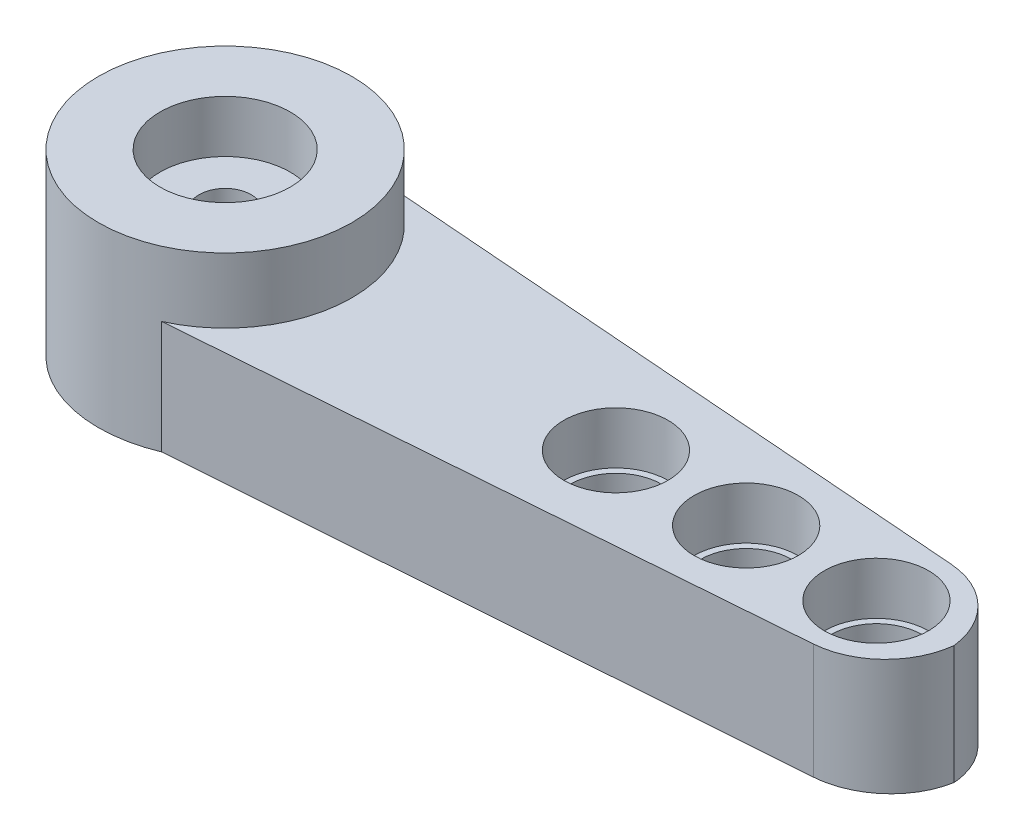
from build123d import *
from build123d.topology import SkipClean

# Parameters (mm, degrees)
SKETCH1_R                = 0.6
BOSS_EXTRUDE1_DEPTH      = 1.4
SKETCH2_R                = 2.6
CUT_EXTRUDE1_DEPTH       = 1
SKETCH3_R                = 3.5
SKETCH3_R_2              = 1
BOSS_EXTRUDE2_DEPTH      = 2.5
SKETCH4_R                = 1.2
CUT_EXTRUDE2_DEPTH       = 20.282440198
SKETCH6_W                = 35.735260114
SKETCH6_H                = 17.672039004
CUT_EXTRUDE4_DEPTH       = 20.513392837
CUT_EXTRUDE5_DEPTH       = 18.980545042
SKETCH_1_R               = 0.75
EXTRUDE_1_DEPTH          = 2
EXTRUDE_START            = 0.6
SKETCH_2_R               = 0.6
SKETCH_2_R_2             = 2.6
EXTRUDE_2_DEPTH          = 0.6
CUT_EXTRUDE_1_DEPTH      = 26.836795467
CUT_EXTRUDE_1_DEPTH_BACK = 26.836795467
SKETCH_3_R               = 0.75
SKETCH_3_R_2             = 0.6
EXTRUDE_3_REACH          = 27.837
EXTRUDE_4_DEPTH          = 2
CUT_EXTRUDE_2_DEPTH      = 10
CUT_EXTRUDE_2_DEPTH_BACK = 2
SKETCH_7_R               = 2
FILLET_1_R               = 3
EXTRUDE_START_2          = 3
SKETCH_9_R               = 1.75
SKETCH_9_R_2             = 2.6
EXTRUDE_5_DEPTH          = 3
EXTRUDE_START_3          = -5
SKETCH_10_R              = 4.86502339
SKETCH_10_R_2            = 3.625748898
EXTRUDE_6_DEPTH          = 5
CUT_EXTRUDE_5_DEPTH      = 0.6
CUT_EXTRUDE_5_DEPTH_BACK = 30.442340009
SKETCH_13_W              = 39.79025269
SKETCH_13_H              = 26.985080274
EXTRUDE_START_4          = -2.9
SKETCH_14_R              = 4.86502339
SKETCH_14_R_2            = 1
EXTRUDE_7_DEPTH          = 2.9
SKETCH_15_R              = 2.5
CUT_EXTRUDE_6_DEPTH      = 2
EXTRUDE_START_5          = 2
SKETCH_16_R              = 2.6
SKETCH_16_R_2            = 1
EXTRUDE_8_DEPTH          = 2


with BuildPart() as part:
    # Sketch1 → Boss-Extrude1 (new body)
    with BuildSketch(Plane(origin=(0, 0, 0), x_dir=(1, 0, 0), z_dir=(0, 1, 0))):
        with BuildLine():
            Line((-15.2, 2), (-2, 2.95))
            Line((-2, 2.95), (-2, 6.35))
            ThreePointArc((-2, 6.35), (0, 8.35), (2, 6.35))
            Line((2, 6.35), (2, 3.5))
            Line((2, 3.5), (15.2, 2))
            ThreePointArc((15.2, 2), (17.2, 0), (15.2, -2))
            Line((15.2, -2), (2, -3.5))
            Line((2, -3.5), (2, -6.35))
            ThreePointArc((2, -6.35), (0, -8.35), (-2, -6.35))
            Line((-2, -6.35), (-2, -2.95))
            Line((-2, -2.95), (-15.2, -2))
            ThreePointArc((-15.2, -2), (-17.2, 0), (-15.2, 2))
        make_face()
        with Locations(Location((0, 6.35, 0), (0, 0, 270))):
            Circle(SKETCH1_R, mode=Mode.SUBTRACT)
        with Locations(Location((0, 4.75, 0), (0, 0, 270))):
            Circle(SKETCH1_R, mode=Mode.SUBTRACT)
        with Locations(Location((0, -4.75, 0), (0, 0, 90))):
            Circle(SKETCH1_R, mode=Mode.SUBTRACT)
        with Locations(Location((0, -6.35, 0), (0, 0, 90))):
            Circle(SKETCH1_R, mode=Mode.SUBTRACT)
        with Locations(Location((-15.2, 0, 0), (0, 0, 270))):
            Circle(SKETCH1_R, mode=Mode.SUBTRACT)
        with Locations(Location((15.2, 0, 0), (0, 0, 270))):
            Circle(SKETCH1_R, mode=Mode.SUBTRACT)
        with Locations(Location((-13.4, 0, 0), (0, 0, 270))):
            Circle(SKETCH1_R, mode=Mode.SUBTRACT)
        with Locations(Location((-11.6, 0, 0), (0, 0, 270))):
            Circle(SKETCH1_R, mode=Mode.SUBTRACT)
        with Locations(Location((-9.8, 0, 0), (0, 0, 270))):
            Circle(SKETCH1_R, mode=Mode.SUBTRACT)
        with Locations(Location((-8, 0, 0), (0, 0, 270))):
            Circle(SKETCH1_R, mode=Mode.SUBTRACT)
        with Locations(Location((-6.2, 0, 0), (0, 0, 270))):
            Circle(SKETCH1_R, mode=Mode.SUBTRACT)
        with Locations(Location((-4.4, 0, 0), (0, 0, 270))):
            Circle(SKETCH1_R, mode=Mode.SUBTRACT)
        with Locations(Location((13.4, 0, 0), (0, 0, 270))):
            Circle(SKETCH1_R, mode=Mode.SUBTRACT)
        with Locations(Location((11.6, 0, 0), (0, 0, 270))):
            Circle(SKETCH1_R, mode=Mode.SUBTRACT)
        with Locations(Location((9.8, 0, 0), (0, 0, 270))):
            Circle(SKETCH1_R, mode=Mode.SUBTRACT)
        with Locations(Location((8, 0, 0), (0, 0, 270))):
            Circle(SKETCH1_R, mode=Mode.SUBTRACT)
        with Locations(Location((6.2, 0, 0), (0, 0, 270))):
            Circle(SKETCH1_R, mode=Mode.SUBTRACT)
        with Locations(Location((4.4, 0, 0), (0, 0, 270))):
            Circle(SKETCH1_R, mode=Mode.SUBTRACT)
    extrude(amount=BOSS_EXTRUDE1_DEPTH)

    # Sketch2 → Cut-Extrude1 (cut)
    with BuildSketch(Plane.XZ):
        with Locations(Location((0, 0, 0), (0, 0, 270))):
            Circle(SKETCH2_R)
    extrude(amount=-CUT_EXTRUDE1_DEPTH, mode=Mode.SUBTRACT)

    # Sketch3 → Boss-Extrude2 (add)
    with BuildSketch(Plane(origin=(0, 1.4, 0), x_dir=(1, 0, 0), z_dir=(0, 1, 0))):
        with Locations(Location((0, 0, 0), (0, 0, 270))):
            Circle(SKETCH3_R)
        with Locations(Location((0, 0, 0), (0, 0, 270))):
            Circle(SKETCH3_R_2, mode=Mode.SUBTRACT)
    extrude(amount=BOSS_EXTRUDE2_DEPTH)

    # Sketch4 → Cut-Extrude2 (cut, through all)
    with BuildSketch(Plane(origin=(0, 1.4, 0), x_dir=(1, 0, 0), z_dir=(0, 1, 0))):
        with Locations(Location((0, 0, 0), (0, 0, 270))):
            Circle(SKETCH4_R)
    extrude(amount=-CUT_EXTRUDE2_DEPTH, mode=Mode.SUBTRACT)

    # Sketch6 → Cut-Extrude4 (cut, through all)
    with BuildSketch(Plane.XZ):
        Rectangle(SKETCH6_W, SKETCH6_H)
        with BuildLine():
            Line((-1.868584713, -2.959457918), (-15.2, -2))
            ThreePointArc((-15.2, -2), (-17.2, 0), (-15.2, 2))
            Line((-15.2, 2), (-1.868584713, 2.959457918))
            ThreePointArc((-1.868584713, 2.959457918), (0, 3.5), (1.868584713, 2.959457918))
            Line((1.868584713, 2.959457918), (15.2, 2))
            ThreePointArc((15.2, 2), (17.2, 0), (15.2, -2))
            Line((15.2, -2), (1.868584713, -2.959457918))
            ThreePointArc((1.868584713, -2.959457918), (0, -3.5), (-1.868584713, -2.959457918))
        make_face(mode=Mode.SUBTRACT)
    extrude(amount=-CUT_EXTRUDE4_DEPTH, mode=Mode.SUBTRACT)

    # Sketch7 → Cut-Extrude5 (cut, through all)
    with BuildSketch(Plane.XZ):
        with BuildLine():
            Line((0, 3.5), (-17.731768104, 3.5))
            Line((-17.731768104, 3.5), (-17.731768104, -3.5))
            Line((-17.731768104, -3.5), (0, -3.5))
            ThreePointArc((0, -3.5), (-3.5, 0), (0, 3.5))
        make_face()
    extrude(amount=-CUT_EXTRUDE5_DEPTH, mode=Mode.SUBTRACT)

    # 草圖1 → 填料-伸長1 (add)
    with BuildSketch(Plane(origin=(0, 1.4, 0), x_dir=(1, 0, 0), z_dir=(0, 1, 0))):
        with BuildLine():
            Line((15.2, 2), (23.2, 2))
            ThreePointArc((23.2, 2), (25.2, 0), (23.2, -2))
            Line((23.2, -2), (15.2, -2))
            Line((15.2, -2), (15.2, 2))
        make_face()
        with Locations(Location((17.2, 0, 0), (0, 0, 270))):
            Circle(SKETCH_1_R, mode=Mode.SUBTRACT)
        with Locations(Location((19.2, 0, 0), (0, 0, 270))):
            Circle(SKETCH_1_R, mode=Mode.SUBTRACT)
        with Locations(Location((21.2, 0, 0), (0, 0, 270))):
            Circle(SKETCH_1_R, mode=Mode.SUBTRACT)
        with Locations(Location((23.2, 0, 0), (0, 0, 270))):
            Circle(SKETCH_1_R, mode=Mode.SUBTRACT)
    extrude(amount=-EXTRUDE_1_DEPTH)

    # 草圖2 → 填料-伸長2 (add)
    with SkipClean():  # the faces are left unmerged after this step: merging them gives an invalid solid
        with BuildSketch(Plane.XZ.offset(EXTRUDE_START)):
            with BuildLine():
                ThreePointArc((1.868584713, 2.959457918), (-3.5, 0), (1.868584713, -2.959457918))
                Line((1.868584713, -2.959457918), (15.2, -2))
                Line((15.2, -2), (15.2, -0.6))
                ThreePointArc((15.2, -0.6), (14.6, 0), (15.2, 0.6))
                Line((15.2, 0.6), (15.2, 2))
                Line((15.2, 2), (1.868584713, 2.959457918))
            make_face()
            with Locations(Location((11.6, 0, 0), (0, 0, 270))):
                Circle(SKETCH_2_R, mode=Mode.SUBTRACT)
            with Locations(Location((8, 0, 0), (0, 0, 270))):
                Circle(SKETCH_2_R, mode=Mode.SUBTRACT)
            with Locations(Location((4.4, 0, 0), (0, 0, 270))):
                Circle(SKETCH_2_R, mode=Mode.SUBTRACT)
            with Locations(Location((6.2, 0, 0), (0, 0, 270))):
                Circle(SKETCH_2_R, mode=Mode.SUBTRACT)
            with Locations(Location((9.8, 0, 0), (0, 0, 270))):
                Circle(SKETCH_2_R, mode=Mode.SUBTRACT)
            with Locations(Location((13.4, 0, 0), (0, 0, 270))):
                Circle(SKETCH_2_R, mode=Mode.SUBTRACT)
            with Locations(Location((0, 0, 0), (0, 0, 270))):
                Circle(SKETCH_2_R_2, mode=Mode.SUBTRACT)
        extrude(amount=-EXTRUDE_2_DEPTH)

    # 草圖3 → 除料-伸長1 (cut, two sides: drawn at the far end of the back side and taken through both)
    with SkipClean():  # the faces are left unmerged after this step: merging them gives an invalid solid
        with BuildSketch(Plane.XZ.offset(0.6).offset(-CUT_EXTRUDE_1_DEPTH_BACK)):
            with Locations(Location((17.2, 0, 0), (0, 0, 90))):
                Circle(SKETCH_3_R)
            with Locations(Location((15.2, 0, 0), (0, 0, 270))):
                Circle(SKETCH_3_R_2)
        extrude(amount=CUT_EXTRUDE_1_DEPTH + CUT_EXTRUDE_1_DEPTH_BACK, mode=Mode.SUBTRACT)

    # 填料-伸長3: up to this face of the body (flat: up to its plane)
    extrude_3_end = Plane(part.part.faces().sort_by_distance((0, 3.9, -3.401005051))[0])
    # 草圖4 → 填料-伸長3 (add, up to the picked face)
    with BuildSketch(Plane.XZ.offset(0.6), mode=Mode.PRIVATE) as extrude_3_sk1:
        with BuildLine():
            Line((1.868584713, 2.959457918), (3.972845963, 2.808014874))
            ThreePointArc((3.972845963, 2.808014874), (-4.86502339, 0), (3.972845963, -2.808014874))
            Line((3.972845963, -2.808014874), (1.868584713, -2.959457918))
            ThreePointArc((1.868584713, -2.959457918), (-3.5, 0), (1.868584713, 2.959457918))
        make_face()
    extrude_3_tool1 = split(extrude(extrude_3_sk1.sketch, amount=-EXTRUDE_3_REACH, mode=Mode.PRIVATE), bisect_by=extrude_3_end, keep=Keep.BOTH, mode=Mode.PRIVATE)
    add(extrude_3_tool1.solids().sort_by(Axis((2.930151, -0.6, -3.014844), (0, 1, 0)))[0])

    # 草圖5 → 填料-伸長4 (add)
    with BuildSketch(Plane.XZ.offset(0.6)):
        Polygon((2, 4.434912917), (28, 2.434912917), (28, -2.434912917), (2, -4.434912917), (3, 0), align=None)
    extrude(amount=-EXTRUDE_4_DEPTH)

    # 草圖7 → 除料-伸長2 (cut, two sides: drawn at the far end of the back side and taken through both)
    with BuildSketch(Plane.XZ.offset(0.6).offset(-CUT_EXTRUDE_2_DEPTH_BACK)):
        with Locations(Location((15, 0, 0), (0, 0, 90))):
            Circle(SKETCH_7_R)
        with Locations(Location((25, 0, 0), (0, 0, 90))):
            Circle(SKETCH_7_R)
        with Locations(Location((20, 0, 0), (0, 0, 90))):
            Circle(SKETCH_7_R)
    extrude(amount=CUT_EXTRUDE_2_DEPTH + CUT_EXTRUDE_2_DEPTH_BACK, mode=Mode.SUBTRACT)

    # 圓角1
    # the kernel refuses this fillet: 3 mm, written as the material it takes off along each edge
    with BuildSketch(Plane(origin=(28, -7.545233544, -2.434912917), x_dir=(-0.9970544855015815, 0, -0.07669649888473681), z_dir=(0, 1, 0)), Plane(origin=(28, -7.545233544, 2.434912917), x_dir=(0, 0, -1), z_dir=(0, 1, 0))) as fillet_1_piece_1:
        with BuildLine():
            CenterArc((FILLET_1_R * 0.926031139262, FILLET_1_R), FILLET_1_R, 184.398705355, 85.601294645)
            Line((-FILLET_1_R * 0.0710233462396, FILLET_1_R * 0.923303501115), (0, 0))
            Line((0, 0), (FILLET_1_R * 0.926031139262, 0))
        make_face()
    extrude(amount=15.890467089, mode=Mode.SUBTRACT)

    # 草圖9 → 填料-伸長5 (add)
    with BuildSketch(Plane.XZ.offset(0.6).offset(EXTRUDE_START_2)):
        with BuildLine():
            Line((2, -4.434912917), (25.230089497, -2.647982956))
            ThreePointArc((25.230089497, -2.647982956), (27.080772484, -1.817927055), (27.980306552, 0))
            ThreePointArc((27.980306552, 0), (27.080772484, 1.817927055), (25.230089497, 2.647982956))
            Line((25.230089497, 2.647982956), (2, 4.434912917))
            ThreePointArc((2, 4.434912917), (-4.86502339, 0), (2, -4.434912917))
        make_face()
        with Locations(Location((20, 0, 0), (0, 0, 270))):
            Circle(SKETCH_9_R, mode=Mode.SUBTRACT)
        with Locations(Location((0, 0, 0), (0, 0, 270))):
            Circle(SKETCH_9_R_2, mode=Mode.SUBTRACT)
        with Locations(Location((15, 0, 0), (0, 0, 270))):
            Circle(SKETCH_9_R, mode=Mode.SUBTRACT)
        with Locations(Location((25, 0, 0), (0, 0, 270))):
            Circle(SKETCH_9_R, mode=Mode.SUBTRACT)
    extrude(amount=-EXTRUDE_5_DEPTH)

    # 草圖10 → 填料-伸長6 (add)
    with SkipClean():  # the faces are left unmerged after this step: merging them gives an invalid solid
        with BuildSketch(Plane(origin=(0, 3.9, 0), x_dir=(1, 0, 0), z_dir=(0, 1, 0)).offset(EXTRUDE_START_3)):
            with Locations(Location((0, 0, 0), (0, 0, 65.726189772))):
                Circle(SKETCH_10_R)
            Circle(SKETCH_10_R_2, mode=Mode.SUBTRACT)
        extrude(amount=EXTRUDE_6_DEPTH)

    # 草圖13 → 除料-伸長5 (cut, two sides: drawn at the far end of the back side and taken through both)
    with SkipClean():  # the faces are left unmerged after this step: merging them gives an invalid solid
        with BuildSketch(Plane(origin=(0, -3.746497551, 0.183234299), x_dir=(-1, 0, 0), z_dir=(0, 0.9988061373414341, -0.04884976979561333)).offset(-CUT_EXTRUDE_5_DEPTH_BACK)):
            with Locations((-13.477412417, -0.191670973)):
                Rectangle(SKETCH_13_W, SKETCH_13_H)
        extrude(amount=CUT_EXTRUDE_5_DEPTH + CUT_EXTRUDE_5_DEPTH_BACK, mode=Mode.SUBTRACT)

    # 草圖14 → 填料-伸長7 (add)
    with SkipClean():  # the faces are left unmerged after this step: merging them gives an invalid solid
        with BuildSketch(Plane(origin=(0, 3.9, 0), x_dir=(1, 0, 0), z_dir=(0, 1, 0)).offset(EXTRUDE_START_4)):
            with Locations(Location((0, 0, 0), (0, 0, 65.726189772))):
                Circle(SKETCH_14_R)
            with Locations(Location((0, 0, 0), (0, 0, 90))):
                Circle(SKETCH_14_R_2, mode=Mode.SUBTRACT)
        extrude(amount=EXTRUDE_7_DEPTH)

    # 草圖15 → 除料-伸長6 (cut)
    with SkipClean():  # the faces are left unmerged after this step: merging them gives an invalid solid
        with BuildSketch(Plane(origin=(0, 3.9, 0), x_dir=(1, 0, 0), z_dir=(0, 1, 0))):
            with Locations(Location((0, 0, 0), (0, 0, 270))):
                Circle(SKETCH_15_R)
        extrude(amount=-CUT_EXTRUDE_6_DEPTH, mode=Mode.SUBTRACT)

    # 草圖16 → 填料-伸長8 (add)
    with SkipClean():  # the faces are left unmerged after this step: merging them gives an invalid solid
        with BuildSketch(Plane.XZ.offset(-1).offset(EXTRUDE_START_5)):
            with Locations(Location((0, 0, 0), (0, 0, 270))):
                Circle(SKETCH_16_R)
            with Locations(Location((0, 0, 0), (0, 0, 270))):
                Circle(SKETCH_16_R_2, mode=Mode.SUBTRACT)
        extrude(amount=-EXTRUDE_8_DEPTH)


solid = part.part
